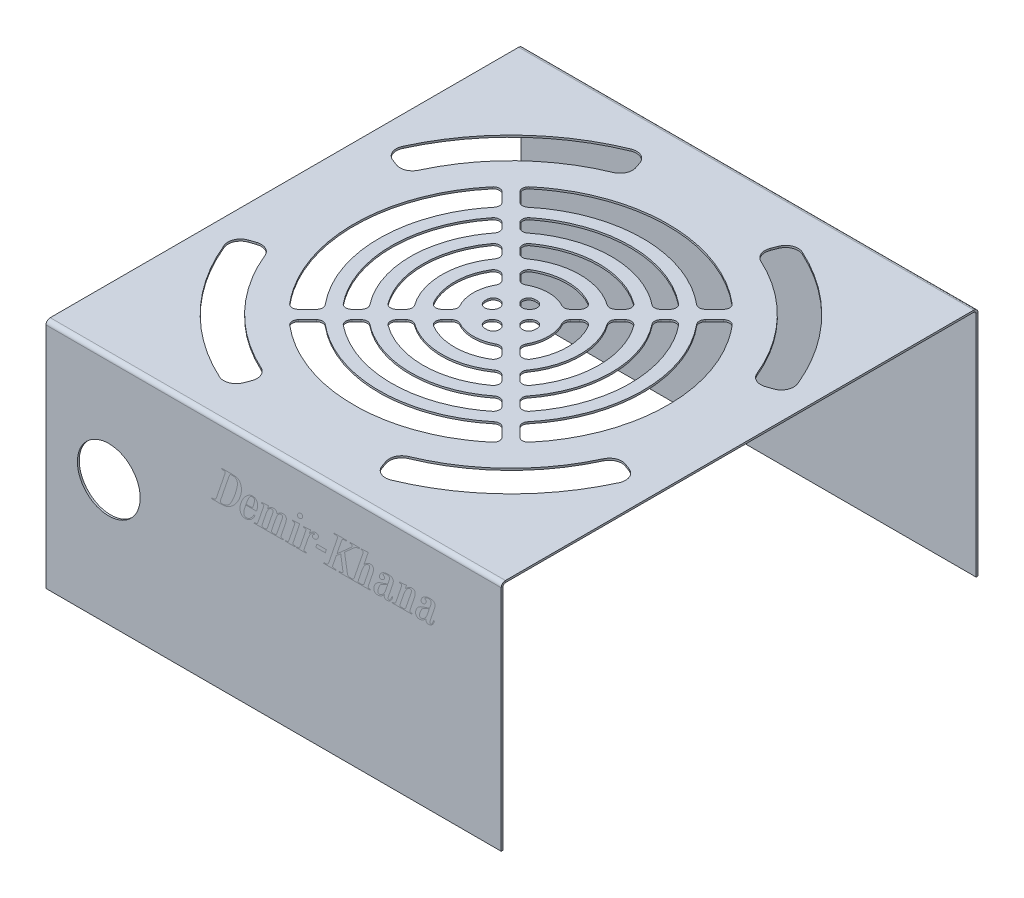
from build123d import *

# Parameters (mm, degrees)
BASE_FLANGE1_DEPTH = 72.5
VENT1_START        = 73.44
VENT1_DEPTH        = 0.6
CUT_EXTRUDE1_DEPTH = 10
SKETCH8_R          = 10
CUT_EXTRUDE2_DEPTH = 0.6


# Read off the part's stored shape, not the designer's step: Vent1
# Sheet-metal steps are written as plain solids
with BuildPart() as part:
    # Sketch1 → Base-Flange1 (new, symmetric)
    with BuildSketch(Plane(origin=(0, 0, 0), x_dir=(0, 0, -1), z_dir=(1, 0, 0))):
        with BuildLine():
            Line((0, 0), (0, 72.7034))
            ThreePointArc((0, 72.7034), (0.215745145, 73.224254855), (0.7366, 73.44))
            Line((0.7366, 73.44), (149.9334, 73.44))
            ThreePointArc((149.9334, 73.44), (150.454254855, 73.224254855), (150.67, 72.7034))
            Line((150.67, 72.7034), (150.67, 0))
            Line((150.67, 0), (151.27, 0))
            Line((151.27, 0), (151.27, 72.7034))
            ThreePointArc((151.27, 72.7034), (150.878518924, 73.648518924), (149.9334, 74.04))
            Line((149.9334, 74.04), (0.7366, 74.04))
            ThreePointArc((0.7366, 74.04), (-0.208518924, 73.648518924), (-0.6, 72.7034))
            Line((-0.6, 72.7034), (-0.6, 0))
            Line((-0.6, 0), (0, 0))
        make_face()
    extrude(amount=BASE_FLANGE1_DEPTH, both=True)

    # Vent1 outline → Vent1 (cut)
    with BuildSketch(Plane(origin=(0, 0, 0), x_dir=(1, 0, 0), z_dir=(0, 1, 0)).offset(VENT1_START)):
        with BuildLine():
            ThreePointArc((-35.237668545, 107.40924142), (-36.735185194, 107.993292253), (-38.17889489, 107.286628399))
            add(Edge.make_bspline(
                [(-38.17889489, 107.286628399), (-38.337593554, 107.099004687), (-39.542377698, 105.653034091), (-41.639734537, 102.823002226), (-44.167935511, 98.608358751), (-46.267637176, 94.164881819), (-47.925023327, 89.537993996), (-49.117500466, 84.770265753), (-49.840379372, 79.908942285), (-50.079805759, 75.000183853), (-49.840397589, 70.091242674), (-49.117572202, 65.230094889), (-47.925077278, 60.462183854), (-46.267777889, 55.8354579), (-44.16802313, 51.391805148), (-41.639938796, 47.177303544), (-39.542488916, 44.347113272), (-38.33771236, 42.901135881), (-38.178894637, 42.713371463)],
                knots=[0.388277454, 0.388277454, 0.388277454, 0.388277454, 0.390624117, 0.406249996, 0.421874117, 0.437499996, 0.453124117, 0.468749996, 0.484374117, 0.499999996, 0.515624117, 0.531249996, 0.546874117, 0.562499996, 0.578124117, 0.593749996, 0.609374117, 0.61172254, 0.61172254, 0.61172254, 0.61172254], degree=3))
            ThreePointArc((-38.178894637, 42.713371463), (-36.735184981, 42.006707815), (-35.237668471, 42.590758654))
            Line((-35.237668471, 42.590758654), (-32.398421968, 45.430005157))
            ThreePointArc((-32.398421968, 45.430005157), (-31.814704678, 46.753266478), (-32.275778554, 48.124090054))
            add(Edge.make_bspline(
                [(-32.275778476, 101.875910081), (-32.339681127, 101.799176391), (-33.279116704, 100.662839753), (-34.977369953, 98.37133243), (-37.101062803, 94.831027013), (-38.864810367, 91.098512463), (-40.25701773, 87.211921101), (-41.258697914, 83.207035691), (-41.865918043, 79.123517909), (-42.067036838, 75.000167139), (-41.865934603, 70.876650236), (-41.258763128, 66.793292165), (-40.257066776, 62.788240582), (-38.86493829, 58.90179637), (-37.101142449, 55.169121994), (-34.977555668, 51.628945513), (-33.279217278, 49.33729472), (-32.339788351, 48.200952392), (-32.275778554, 48.124090054)],
                knots=[0.389488825, 0.389488825, 0.389488825, 0.389488825, 0.390624044, 0.406249995, 0.421874044, 0.437499995, 0.453124044, 0.468749995, 0.484374044, 0.499999995, 0.515624044, 0.531249995, 0.546874044, 0.562499995, 0.578124044, 0.593749995, 0.609374044, 0.610511167, 0.610511167, 0.610511167, 0.610511167], degree=3))
            ThreePointArc((-32.275778476, 101.875910081), (-31.8147047, 103.246733617), (-32.398421987, 104.569994862))
            Line((-32.398421987, 104.569994862), (-35.237668545, 107.40924142))
        make_face()
        with BuildLine():
            ThreePointArc((32.409241439, 110.237668563), (32.993292271, 111.735185236), (32.286628381, 113.17889494))
            add(Edge.make_bspline(
                [(32.286628381, 113.17889494), (32.099004677, 113.33759359), (30.653034061, 114.542377664), (27.822998563, 116.639736542), (23.608356035, 119.167939391), (19.164870079, 121.267641643), (14.537985982, 122.925025916), (9.770249341, 124.11750369), (4.908933883, 124.84038021), (0.000167137, 125.079805759), (-4.908765728, 124.840396753), (-9.769921523, 124.117568978), (-14.53782416, 122.925074689), (-19.164553841, 121.267773423), (-23.60819756, 119.168019245), (-27.822700147, 116.639936816), (-30.652886651, 114.542488918), (-32.098864078, 113.337712403), (-32.28662848, 113.178894708)],
                knots=[0.138277454, 0.138277454, 0.138277454, 0.138277454, 0.140624117, 0.156249996, 0.171874157, 0.187499996, 0.203124197, 0.218749996, 0.234374197, 0.249999996, 0.265624197, 0.281249996, 0.296874197, 0.312499996, 0.328124157, 0.343749996, 0.359374117, 0.361722539, 0.361722539, 0.361722539, 0.361722539], degree=3))
            ThreePointArc((-32.28662848, 113.178894708), (-32.993292196, 111.735185039), (-32.409241358, 110.237668483))
            Line((-32.409241358, 110.237668483), (-29.569994843, 107.398421968))
            ThreePointArc((-29.569994843, 107.398421968), (-28.246733522, 106.814704678), (-26.875909946, 107.275778554))
            add(Edge.make_bspline(
                [(26.87591017, 107.275778424), (26.799182886, 107.339675735), (25.662846467, 108.279111594), (23.371342666, 109.977362674), (19.831031747, 112.101062699), (16.098516165, 113.864808438), (12.21192117, 115.257017867), (8.207035672, 116.258697877), (4.123517913, 116.865918052), (0.000167138, 117.067036836), (-4.123349764, 116.865934604), (-8.206707835, 116.258763128), (-12.211759418, 115.257066776), (-16.09820363, 113.86493829), (-19.830878006, 112.101142449), (-23.371054487, 109.977555668), (-25.66270528, 108.279217278), (-26.799047608, 107.339788351), (-26.875909946, 107.275778554)],
                knots=[0.139488824, 0.139488824, 0.139488824, 0.139488824, 0.140623949, 0.156249995, 0.171873996, 0.187499995, 0.203124044, 0.218749995, 0.234374044, 0.249999995, 0.265624044, 0.281249995, 0.296874044, 0.312499995, 0.328124044, 0.343749995, 0.359374044, 0.360511167, 0.360511167, 0.360511167, 0.360511167], degree=3))
            ThreePointArc((26.87591017, 107.275778424), (28.246733679, 106.814704715), (29.569994874, 107.398421999))
            Line((29.569994874, 107.398421999), (32.409241439, 110.237668563))
        make_face()
        with BuildLine():
            ThreePointArc((-32.409242255, 39.762330621), (-32.993293095, 38.264814132), (-32.286629479, 36.821104482))
            add(Edge.make_bspline(
                [(-32.286629479, 36.821104482), (-32.099002484, 36.66240299), (-30.653031738, 35.457618801), (-27.822991581, 33.360258793), (-23.608351397, 30.832060385), (-19.164866351, 28.732356461), (-14.537985919, 27.074974211), (-9.770249358, 25.882496276), (-4.908933878, 25.159619798), (-0.000167139, 24.920194241), (4.908765733, 25.159603238), (9.769921504, 25.882431059), (14.53782423, 27.074925174), (19.164557543, 28.732228506), (23.608202294, 30.831980859), (27.822710384, 33.360070464), (30.652893317, 35.457516171), (32.098870457, 36.66229296), (32.286628455, 36.821105228)],
                knots=[0.638277453, 0.638277453, 0.638277453, 0.638277453, 0.640624157, 0.656249996, 0.671874197, 0.687499996, 0.703124197, 0.718749996, 0.734374197, 0.749999996, 0.765624197, 0.781249996, 0.796874197, 0.812499996, 0.828124197, 0.843749996, 0.859374197, 0.861722539, 0.861722539, 0.861722539, 0.861722539], degree=3))
            ThreePointArc((32.286628455, 36.821105228), (32.993292217, 38.264814907), (32.409241381, 39.762331494))
            Line((32.409241381, 39.762331494), (29.569994843, 42.601578032))
            ThreePointArc((29.569994843, 42.601578032), (28.246733522, 43.185295322), (26.875909946, 42.724221446))
            add(Edge.make_bspline(
                [(-26.875910081, 42.724221524), (-26.799176391, 42.660318873), (-25.662839753, 41.720883296), (-23.37133243, 40.022630047), (-19.831027013, 37.898937197), (-16.098512463, 36.135189633), (-12.211921101, 34.74298227), (-8.207035691, 33.741302086), (-4.123517909, 33.134081957), (-0.000167139, 32.932963162), (4.123349764, 33.134065397), (8.206707835, 33.741236872), (12.211759418, 34.742933224), (16.09820363, 36.13506171), (19.830878006, 37.898857551), (23.371054487, 40.022444332), (25.66270528, 41.720782722), (26.799047608, 42.660211649), (26.875909946, 42.724221446)],
                knots=[0.639488825, 0.639488825, 0.639488825, 0.639488825, 0.640624044, 0.656249995, 0.671874044, 0.687499995, 0.703124044, 0.718749995, 0.734374044, 0.749999995, 0.765624044, 0.781249995, 0.796874044, 0.812499995, 0.828124044, 0.843749995, 0.859374044, 0.860511167, 0.860511167, 0.860511167, 0.860511167], degree=3))
            ThreePointArc((-26.875910081, 42.724221524), (-28.246733617, 43.1852953), (-29.569994862, 42.601578013))
            Line((-29.569994862, 42.601578013), (-32.409242255, 39.762330621))
        make_face()
        with BuildLine():
            ThreePointArc((35.237668542, 42.590758583), (36.735185185, 42.006707749), (38.178894879, 42.713371594))
            add(Edge.make_bspline(
                [(38.178894879, 42.713371594), (38.337598954, 42.901001701), (39.542382752, 44.346972604), (41.639743794, 47.177011677), (44.167939595, 51.391648685), (46.267643196, 55.835133674), (47.925027181, 60.462013899), (49.117508708, 65.229792176), (49.840403961, 70.091105929), (50.000006913, 73.363674722), (50, 75), (49.999993088, 76.636236998), (49.840371138, 79.908801135), (49.117566807, 84.76995079), (47.925075713, 89.53781594), (46.26777831, 94.164542157), (44.168023011, 98.608194829), (41.639938851, 102.822696488), (39.542488886, 105.652886622), (38.337712436, 107.098864068), (38.178894755, 107.286628464)],
                knots=[0.888277454, 0.888277454, 0.888277454, 0.888277454, 0.890624197, 0.906249996, 0.921874197, 0.937499996, 0.953124197, 0.968749996, 0.984374599, 1, 1, 1, 1.015624558, 1.031249996, 1.046874117, 1.062499996, 1.078124117, 1.093749996, 1.109374117, 1.111722539, 1.111722539, 1.111722539, 1.111722539], degree=3))
            ThreePointArc((38.178894755, 107.286628464), (36.735185079, 107.993292213), (35.237668501, 107.409241376))
            Line((35.237668501, 107.409241376), (32.398421965, 104.569994841))
            ThreePointArc((32.398421965, 104.569994841), (31.814704675, 103.246733509), (32.275778565, 101.875909927))
            add(Edge.make_bspline(
                [(32.275778474, 48.124089915), (32.339681125, 48.200823606), (33.2791167, 49.337160246), (34.977369926, 51.628667574), (37.101062903, 55.168972973), (38.864809991, 58.901487587), (40.257019132, 62.788078711), (41.258702895, 66.793005846), (41.865941804, 70.876521899), (42.000006913, 73.625480045), (42, 75), (41.999993088, 76.374431675), (41.86590898, 79.123385165), (41.258760994, 83.20673712), (40.257067663, 87.211751128), (38.864945105, 91.098188243), (37.101146318, 94.830870541), (34.977564983, 98.371040592), (33.279222316, 100.662698558), (32.339793717, 101.79904116), (32.275778565, 101.875909927)],
                knots=[0.889488825, 0.889488825, 0.889488825, 0.889488825, 0.890624044, 0.906249995, 0.921874044, 0.937499995, 0.953124044, 0.968749995, 0.984374522, 1, 1, 1, 1.015624474, 1.031249995, 1.046873949, 1.062499995, 1.078123949, 1.093749995, 1.109373949, 1.110511166, 1.110511166, 1.110511166, 1.110511166], degree=3))
            ThreePointArc((32.275778474, 48.124089915), (31.814704701, 46.753266381), (32.398421987, 45.430005138))
            Line((32.398421987, 45.430005138), (35.237668542, 42.590758583))
        make_face()
        with BuildLine():
            ThreePointArc((-1.748044523, 70.423528352), (-2.202201241, 68.295737536), (-0.445257533, 67.012421172))
            add(Edge.make_bspline(
                [(-0.445257533, 67.012421172), (-0.296991368, 67.004147926), (0, 66.995852074), (0.296991368, 67.004147926), (0.445257551, 67.012421173)],
                knots=[0.741137243, 0.741137243, 0.741137243, 0.741137243, 0.75, 0.758862757, 0.758862757, 0.758862757, 0.758862757], degree=3))
            ThreePointArc((0.445257551, 67.012421173), (2.202201241, 68.295737535), (1.748044523, 70.423528352))
            Line((1.748044523, 70.423528352), (1.414213562, 70.757359313))
            ThreePointArc((1.414213562, 70.757359313), (0, 71.343145751), (-1.414213562, 70.757359313))
            Line((-1.414213562, 70.757359313), (-1.748044523, 70.423528352))
        make_face()
        with BuildLine():
            add(Edge.make_bspline(
                [(-5.707183993, 64.44410446), (-5.344945674, 64.248259161), (-4.26255561, 63.733002904), (-2.356174944, 63.154708651), (0, 62.922645674), (2.356174944, 63.154708651), (4.262555613, 63.733002905), (5.344945679, 64.248259164), (5.707184, 64.444104464)],
                knots=[0.671115403, 0.671115403, 0.671115403, 0.671115403, 0.6875, 0.71875, 0.75, 0.78125, 0.8125, 0.828884597, 0.828884597, 0.828884597, 0.828884597], degree=3))
            ThreePointArc((-5.707183993, 64.44410446), (-6.947118124, 64.663820908), (-8.072584978, 64.098987897))
            Line((-8.072584978, 64.098987897), (-9.540203201, 62.631369674))
            ThreePointArc((-9.540203201, 62.631369674), (-10.110041057, 60.965084752), (-9.141633618, 59.494232055))
            add(Edge.make_bspline(
                [(-9.141633618, 59.494232055), (-8.417949604, 59.067628623), (-6.607666297, 58.164369851), (-3.534262417, 57.232062977), (0, 56.883968512), (3.534262417, 57.232062977), (6.607666296, 58.164369851), (8.417949603, 59.067628622), (9.141633653, 59.494232075)],
                knots=[0.665216574, 0.665216574, 0.665216574, 0.665216574, 0.6875, 0.71875, 0.75, 0.78125, 0.8125, 0.834783426, 0.834783426, 0.834783426, 0.834783426], degree=3))
            ThreePointArc((9.141633653, 59.494232075), (10.110041057, 60.965084752), (9.540203201, 62.631369674))
            Line((9.540203201, 62.631369674), (8.072584978, 64.098987897))
            ThreePointArc((8.072584978, 64.098987897), (6.947118124, 64.663820908), (5.707184, 64.444104464))
        make_face()
        with BuildLine():
            ThreePointArc((-4.576471648, 76.748044523), (-6.704262464, 77.202201241), (-7.987578828, 75.445257533))
            add(Edge.make_bspline(
                [(-7.987578828, 75.445257533), (-7.995852074, 75.296991368), (-8.004147926, 75), (-7.995852074, 74.703008632), (-7.987578827, 74.554742449)],
                knots=[0.491137243, 0.491137243, 0.491137243, 0.491137243, 0.5, 0.508862757, 0.508862757, 0.508862757, 0.508862757], degree=3))
            ThreePointArc((-7.987578827, 74.554742449), (-6.704262465, 72.797798759), (-4.576471648, 73.251955477))
            Line((-4.576471648, 73.251955477), (-4.242640687, 73.585786438))
            ThreePointArc((-4.242640687, 73.585786438), (-3.656854249, 75), (-4.242640687, 76.414213562))
            Line((-4.242640687, 76.414213562), (-4.576471648, 76.748044523))
        make_face()
        with BuildLine():
            add(Edge.make_bspline(
                [(-10.55589554, 80.707183993), (-10.751740839, 80.344945674), (-11.266997096, 79.26255561), (-11.845291349, 77.356174944), (-12.077354326, 75), (-11.845291349, 72.643825056), (-11.266997095, 70.737444387), (-10.751740836, 69.655054321), (-10.555895536, 69.292816)],
                knots=[0.421115403, 0.421115403, 0.421115403, 0.421115403, 0.4375, 0.46875, 0.5, 0.53125, 0.5625, 0.578884597, 0.578884597, 0.578884597, 0.578884597], degree=3))
            ThreePointArc((-10.55589554, 80.707183993), (-10.336179092, 81.947118124), (-10.901012103, 83.072584978))
            Line((-10.901012103, 83.072584978), (-12.368630326, 84.540203201))
            ThreePointArc((-12.368630326, 84.540203201), (-14.034915248, 85.110041057), (-15.505767945, 84.141633618))
            add(Edge.make_bspline(
                [(-15.505767945, 84.141633618), (-15.932371377, 83.417949604), (-16.835630149, 81.607666297), (-17.767937023, 78.534262417), (-18.116031488, 75), (-17.767937023, 71.465737583), (-16.835630149, 68.392333704), (-15.932371378, 66.582050397), (-15.505767925, 65.858366347)],
                knots=[0.415216574, 0.415216574, 0.415216574, 0.415216574, 0.4375, 0.46875, 0.5, 0.53125, 0.5625, 0.584783426, 0.584783426, 0.584783426, 0.584783426], degree=3))
            ThreePointArc((-15.505767925, 65.858366347), (-14.034915248, 64.889958943), (-12.368630326, 65.459796799))
            Line((-12.368630326, 65.459796799), (-10.901012103, 66.927415022))
            ThreePointArc((-10.901012103, 66.927415022), (-10.336179092, 68.052881876), (-10.555895536, 69.292816))
        make_face()
        with BuildLine():
            ThreePointArc((1.748044523, 79.576471648), (2.202201241, 81.704262464), (0.445257533, 82.987578828))
            add(Edge.make_bspline(
                [(0.445257533, 82.987578828), (0.296991368, 82.995852074), (0, 83.004147926), (-0.296991368, 82.995852074), (-0.445257551, 82.987578827)],
                knots=[0.241137243, 0.241137243, 0.241137243, 0.241137243, 0.25, 0.258862757, 0.258862757, 0.258862757, 0.258862757], degree=3))
            ThreePointArc((-0.445257551, 82.987578827), (-2.202201241, 81.704262465), (-1.748044523, 79.576471648))
            Line((-1.748044523, 79.576471648), (-1.414213562, 79.242640687))
            ThreePointArc((-1.414213562, 79.242640687), (0, 78.656854249), (1.414213562, 79.242640687))
            Line((1.414213562, 79.242640687), (1.748044523, 79.576471648))
        make_face()
        with BuildLine():
            add(Edge.make_bspline(
                [(5.707183993, 85.55589554), (5.344945674, 85.751740839), (4.26255561, 86.266997096), (2.356174944, 86.845291349), (0, 87.077354326), (-2.356174944, 86.845291349), (-4.262555613, 86.266997095), (-5.344945679, 85.751740836), (-5.707184, 85.555895536)],
                knots=[0.171115403, 0.171115403, 0.171115403, 0.171115403, 0.1875, 0.21875, 0.25, 0.28125, 0.3125, 0.328884597, 0.328884597, 0.328884597, 0.328884597], degree=3))
            ThreePointArc((5.707183993, 85.55589554), (6.947118124, 85.336179092), (8.072584978, 85.901012103))
            Line((8.072584978, 85.901012103), (9.540203201, 87.368630326))
            ThreePointArc((9.540203201, 87.368630326), (10.110041057, 89.034915248), (9.141633618, 90.505767945))
            add(Edge.make_bspline(
                [(9.141633618, 90.505767945), (8.417949604, 90.932371377), (6.607666297, 91.835630149), (3.534262417, 92.767937023), (0, 93.116031488), (-3.534262417, 92.767937023), (-6.607666296, 91.835630149), (-8.417949603, 90.932371378), (-9.141633653, 90.505767925)],
                knots=[0.165216574, 0.165216574, 0.165216574, 0.165216574, 0.1875, 0.21875, 0.25, 0.28125, 0.3125, 0.334783426, 0.334783426, 0.334783426, 0.334783426], degree=3))
            ThreePointArc((-9.141633653, 90.505767925), (-10.110041057, 89.034915248), (-9.540203201, 87.368630326))
            Line((-9.540203201, 87.368630326), (-8.072584978, 85.901012103))
            ThreePointArc((-8.072584978, 85.901012103), (-6.947118124, 85.336179092), (-5.707184, 85.555895536))
        make_face()
        with BuildLine():
            add(Edge.make_bspline(
                [(10.55589554, 69.292816007), (10.751740839, 69.655054326), (11.266997096, 70.73744439), (11.845291349, 72.643825056), (12, 74.214608352), (12, 75), (12, 75.785391648), (11.845291349, 77.356174944), (11.266997095, 79.262555613), (10.751740836, 80.344945679), (10.555895536, 80.707184)],
                knots=[0.921115403, 0.921115403, 0.921115403, 0.921115403, 0.9375, 0.96875, 1, 1, 1, 1.03125, 1.0625, 1.078884597, 1.078884597, 1.078884597, 1.078884597], degree=3))
            ThreePointArc((10.55589554, 69.292816007), (10.336179092, 68.052881876), (10.901012103, 66.927415022))
            Line((10.901012103, 66.927415022), (12.368630326, 65.459796799))
            ThreePointArc((12.368630326, 65.459796799), (14.034915248, 64.889958943), (15.505767945, 65.858366382))
            add(Edge.make_bspline(
                [(15.505767945, 65.858366382), (15.932371377, 66.582050396), (16.835630149, 68.392333703), (17.767937023, 71.465737583), (18, 73.821912528), (18, 75), (18, 76.178087472), (17.767937023, 78.534262417), (16.835630149, 81.607666296), (15.932371378, 83.417949603), (15.505767925, 84.141633653)],
                knots=[0.915216574, 0.915216574, 0.915216574, 0.915216574, 0.9375, 0.96875, 1, 1, 1, 1.03125, 1.0625, 1.084783426, 1.084783426, 1.084783426, 1.084783426], degree=3))
            ThreePointArc((15.505767925, 84.141633653), (14.034915248, 85.110041057), (12.368630326, 84.540203201))
            Line((12.368630326, 84.540203201), (10.901012103, 83.072584978))
            ThreePointArc((10.901012103, 83.072584978), (10.336179092, 81.947118124), (10.555895536, 80.707184))
        make_face()
        with BuildLine():
            ThreePointArc((4.576471648, 73.251955477), (6.704262466, 72.79779876), (7.987578828, 74.554742471))
            add(Edge.make_bspline(
                [(7.987578828, 74.554742471), (7.995852074, 74.703008632), (8, 74.851504316), (8, 75), (8, 75.148495684), (7.995852074, 75.296991368), (7.987578827, 75.445257551)],
                knots=[0.991137243, 0.991137243, 0.991137243, 0.991137243, 1, 1, 1, 1.008862757, 1.008862757, 1.008862757, 1.008862757], degree=3))
            ThreePointArc((7.987578827, 75.445257551), (6.704262463, 77.202201241), (4.576471648, 76.748044523))
            Line((4.576471648, 76.748044523), (4.242640687, 76.414213562))
            ThreePointArc((4.242640687, 76.414213562), (3.656854249, 75), (4.242640687, 73.585786438))
            Line((4.242640687, 73.585786438), (4.576471648, 73.251955477))
        make_face()
        with BuildLine():
            add(Edge.make_bspline(
                [(-12.745942792, 57.068463804), (-12.573229067, 56.945682241), (-11.213115362, 56.008087624), (-8.473306247, 54.543629141), (-4.319654065, 53.283632527), (0, 52.858183736), (4.319654065, 53.283632527), (8.473306247, 54.543629141), (11.213115362, 56.008087624), (12.573229067, 56.945682241), (12.745942792, 57.068463804)],
                knots=[0.65165093, 0.65165093, 0.65165093, 0.65165093, 0.65625, 0.6875, 0.71875, 0.75, 0.78125, 0.8125, 0.84375, 0.84834907, 0.84834907, 0.84834907, 0.84834907], degree=3))
            ThreePointArc((-12.745942792, 57.068463804), (-14.071959063, 57.43138655), (-15.31897145, 56.852601425))
            Line((-15.31897145, 56.852601425), (-16.751653306, 55.41991957))
            ThreePointArc((-16.751653306, 55.41991957), (-17.331483334, 53.851465415), (-16.517351618, 52.390835125))
            add(Edge.make_bspline(
                [(-16.517351618, 52.390835125), (-16.201632209, 52.160153474), (-14.37874274, 50.885937781), (-10.78420795, 48.964618907), (-5.497741537, 47.360986853), (0, 46.819506574), (5.497741537, 47.360986853), (10.78420795, 48.964618907), (14.37874274, 50.885937781), (16.201632209, 52.160153474), (16.517351619, 52.390835125)],
                knots=[0.649582268, 0.649582268, 0.649582268, 0.649582268, 0.65625, 0.6875, 0.71875, 0.75, 0.78125, 0.8125, 0.84375, 0.850417732, 0.850417732, 0.850417732, 0.850417732], degree=3))
            ThreePointArc((16.517351619, 52.390835125), (17.331483334, 53.851465416), (16.751653306, 55.41991957))
            Line((16.751653306, 55.41991957), (15.31897145, 56.852601425))
            ThreePointArc((15.31897145, 56.852601425), (14.07195906, 57.43138655), (12.745942792, 57.068463804))
        make_face()
        with BuildLine():
            add(Edge.make_bspline(
                [(-17.931536196, 87.745942792), (-18.054317759, 87.573229067), (-18.991912376, 86.213115362), (-20.456370859, 83.473306247), (-21.716367473, 79.319654065), (-22.141816264, 75), (-21.716367473, 70.680345935), (-20.456370859, 66.526693753), (-18.991912376, 63.786884638), (-18.054317759, 62.426770933), (-17.931536196, 62.254057208)],
                knots=[0.40165093, 0.40165093, 0.40165093, 0.40165093, 0.40625, 0.4375, 0.46875, 0.5, 0.53125, 0.5625, 0.59375, 0.59834907, 0.59834907, 0.59834907, 0.59834907], degree=3))
            ThreePointArc((-17.931536196, 87.745942792), (-17.56861345, 89.071959063), (-18.147398575, 90.31897145))
            Line((-18.147398575, 90.31897145), (-19.58008043, 91.751653306))
            ThreePointArc((-19.58008043, 91.751653306), (-21.148534585, 92.331483334), (-22.609164875, 91.517351618))
            add(Edge.make_bspline(
                [(-22.609164875, 91.517351618), (-22.839846526, 91.201632209), (-24.114062219, 89.37874274), (-26.035381093, 85.78420795), (-27.639013147, 80.497741537), (-28.180493426, 75), (-27.639013147, 69.502258463), (-26.035381093, 64.21579205), (-24.114062219, 60.62125726), (-22.839846526, 58.798367791), (-22.609164875, 58.482648381)],
                knots=[0.399582268, 0.399582268, 0.399582268, 0.399582268, 0.40625, 0.4375, 0.46875, 0.5, 0.53125, 0.5625, 0.59375, 0.600417732, 0.600417732, 0.600417732, 0.600417732], degree=3))
            ThreePointArc((-22.609164875, 58.482648381), (-21.148534584, 57.668516666), (-19.58008043, 58.248346694))
            Line((-19.58008043, 58.248346694), (-18.147398575, 59.68102855))
            ThreePointArc((-18.147398575, 59.68102855), (-17.56861345, 60.92804094), (-17.931536196, 62.254057208))
        make_face()
        with BuildLine():
            add(Edge.make_bspline(
                [(12.745942792, 92.931536196), (12.573229067, 93.054317759), (11.213115362, 93.991912376), (8.473306247, 95.456370859), (4.319654065, 96.716367473), (0, 97.141816264), (-4.319654065, 96.716367473), (-8.473306247, 95.456370859), (-11.213115362, 93.991912376), (-12.573229067, 93.054317759), (-12.745942792, 92.931536196)],
                knots=[0.15165093, 0.15165093, 0.15165093, 0.15165093, 0.15625, 0.1875, 0.21875, 0.25, 0.28125, 0.3125, 0.34375, 0.34834907, 0.34834907, 0.34834907, 0.34834907], degree=3))
            ThreePointArc((12.745942792, 92.931536196), (14.071959063, 92.56861345), (15.31897145, 93.147398575))
            Line((15.31897145, 93.147398575), (16.751653306, 94.58008043))
            ThreePointArc((16.751653306, 94.58008043), (17.331483334, 96.148534585), (16.517351618, 97.609164875))
            add(Edge.make_bspline(
                [(16.517351618, 97.609164875), (16.201632209, 97.839846526), (14.37874274, 99.114062219), (10.78420795, 101.035381093), (5.497741537, 102.639013147), (0, 103.180493426), (-5.497741537, 102.639013147), (-10.78420795, 101.035381093), (-14.37874274, 99.114062219), (-16.201632209, 97.839846526), (-16.517351619, 97.609164875)],
                knots=[0.149582268, 0.149582268, 0.149582268, 0.149582268, 0.15625, 0.1875, 0.21875, 0.25, 0.28125, 0.3125, 0.34375, 0.350417732, 0.350417732, 0.350417732, 0.350417732], degree=3))
            ThreePointArc((-16.517351619, 97.609164875), (-17.331483334, 96.148534584), (-16.751653306, 94.58008043))
            Line((-16.751653306, 94.58008043), (-15.31897145, 93.147398575))
            ThreePointArc((-15.31897145, 93.147398575), (-14.07195906, 92.56861345), (-12.745942792, 92.931536196))
        make_face()
        with BuildLine():
            add(Edge.make_bspline(
                [(17.931536196, 62.254057208), (18.054317759, 62.426770933), (18.991912376, 63.786884638), (20.456370859, 66.526693753), (21.716367473, 70.680345935), (22, 73.560115312), (22, 75), (22, 76.439884688), (21.716367473, 79.319654065), (20.456370859, 83.473306247), (18.991912376, 86.213115362), (18.054317759, 87.573229067), (17.931536196, 87.745942792)],
                knots=[0.90165093, 0.90165093, 0.90165093, 0.90165093, 0.90625, 0.9375, 0.96875, 1, 1, 1, 1.03125, 1.0625, 1.09375, 1.09834907, 1.09834907, 1.09834907, 1.09834907], degree=3))
            ThreePointArc((17.931536196, 62.254057208), (17.56861345, 60.928040937), (18.147398575, 59.68102855))
            Line((18.147398575, 59.68102855), (19.58008043, 58.248346694))
            ThreePointArc((19.58008043, 58.248346694), (21.148534585, 57.668516666), (22.609164875, 58.482648382))
            add(Edge.make_bspline(
                [(22.609164875, 58.482648382), (22.839846526, 58.798367791), (24.114062219, 60.62125726), (26.035381093, 64.21579205), (27.639013147, 69.502258463), (28, 73.167419488), (28, 75), (28, 76.832580512), (27.639013147, 80.497741537), (26.035381093, 85.78420795), (24.114062219, 89.37874274), (22.839846526, 91.201632209), (22.609164875, 91.517351619)],
                knots=[0.899582268, 0.899582268, 0.899582268, 0.899582268, 0.90625, 0.9375, 0.96875, 1, 1, 1, 1.03125, 1.0625, 1.09375, 1.100417732, 1.100417732, 1.100417732, 1.100417732], degree=3))
            ThreePointArc((22.609164875, 91.517351619), (21.148534584, 92.331483334), (19.58008043, 91.751653306))
            Line((19.58008043, 91.751653306), (18.147398575, 90.31897145))
            ThreePointArc((18.147398575, 90.31897145), (17.56861345, 89.07195906), (17.931536196, 87.745942792))
        make_face()
        with BuildLine():
            add(Edge.make_bspline(
                [(-19.808104351, 49.8677173), (-19.151097198, 49.349861828), (-16.778177952, 47.625654003), (-12.324809086, 45.245278751), (-6.283133185, 43.412556403), (0, 42.793721798), (6.283133185, 43.412556403), (12.324809086, 45.245278751), (16.778177952, 47.625654003), (19.151097198, 49.349861828), (19.808104351, 49.8677173)],
                knots=[0.643767906, 0.643767906, 0.643767906, 0.643767906, 0.65625, 0.6875, 0.71875, 0.75, 0.78125, 0.8125, 0.84375, 0.856232094, 0.856232094, 0.856232094, 0.856232094], degree=3))
            ThreePointArc((-19.808104351, 49.8677173), (-21.163986968, 50.293508483), (-22.460377231, 49.711195644))
            Line((-22.460377231, 49.711195644), (-23.884306644, 48.287266231))
            ThreePointArc((-23.884306644, 48.287266231), (-24.466989486, 46.761676059), (-23.718269273, 45.310344701))
            add(Edge.make_bspline(
                [(-23.718269273, 45.310344701), (-22.876975008, 44.638380717), (-21.002200978, 43.267855292), (-17.942364964, 41.432375423), (-14.565335481, 39.836606268), (-11.048888702, 38.576986286), (-7.425428855, 37.670704995), (-3.730809924, 37.121313036), (-0.000167139, 36.939347622), (3.73064178, 37.121296476), (7.425101001, 37.670639778), (11.048727012, 38.576937249), (14.565026673, 39.836478313), (17.942215862, 41.432295897), (21.002066601, 43.267756356), (22.876974623, 44.638381519), (23.718268862, 45.310345839)],
                knots=[0.642721101, 0.642721101, 0.642721101, 0.642721101, 0.656249995, 0.671873944, 0.687499995, 0.703123944, 0.718749995, 0.734373944, 0.749999995, 0.765623944, 0.781249995, 0.796873944, 0.812499995, 0.828123944, 0.843749995, 0.857278892, 0.857278892, 0.857278892, 0.857278892], degree=3))
            ThreePointArc((23.718268862, 45.310345839), (24.466988685, 46.761677133), (23.884305829, 48.287267047))
            Line((23.884305829, 48.287267047), (22.460377231, 49.711195644))
            ThreePointArc((22.460377231, 49.711195644), (21.163986971, 50.293508483), (19.808104351, 49.8677173))
        make_face()
        with BuildLine():
            add(Edge.make_bspline(
                [(-25.1322827, 94.808104351), (-25.650138172, 94.151097198), (-27.374345997, 91.778177952), (-29.754721249, 87.324809086), (-31.587443597, 81.283133185), (-32.206278202, 75), (-31.587443597, 68.716866815), (-29.754721249, 62.675190914), (-27.374345997, 58.221822048), (-25.650138172, 55.848902802), (-25.1322827, 55.191895649)],
                knots=[0.393767906, 0.393767906, 0.393767906, 0.393767906, 0.40625, 0.4375, 0.46875, 0.5, 0.53125, 0.5625, 0.59375, 0.606232094, 0.606232094, 0.606232094, 0.606232094], degree=3))
            ThreePointArc((-25.1322827, 94.808104351), (-24.706491517, 96.163986968), (-25.288804356, 97.460377231))
            Line((-25.288804356, 97.460377231), (-26.71273292, 98.884305795))
            ThreePointArc((-26.71273292, 98.884305795), (-28.238322914, 99.466988647), (-29.689654228, 98.718268703))
            add(Edge.make_bspline(
                [(-29.689654228, 98.718268703), (-30.361618413, 97.876974493), (-31.732140169, 96.00220811), (-33.567620473, 92.942372319), (-35.163387369, 89.565350949), (-36.423011252, 86.048896779), (-37.329291747, 82.425445249), (-37.878686134, 78.730818331), (-38.060652378, 75.000183853), (-37.878704351, 71.269366628), (-37.329363483, 67.574915392), (-36.423065203, 63.951281072), (-35.163528082, 60.43498877), (-33.567708091, 57.057791581), (-31.732248533, 53.997940144), (-30.361618498, 52.123025272), (-29.689654124, 51.281731045)],
                knots=[0.392721099, 0.392721099, 0.392721099, 0.392721099, 0.406249994, 0.421873838, 0.437499994, 0.453123838, 0.468749994, 0.484373838, 0.499999994, 0.515623838, 0.531249994, 0.546873838, 0.562499994, 0.578123838, 0.593749994, 0.607278892, 0.607278892, 0.607278892, 0.607278892], degree=3))
            ThreePointArc((-29.689654124, 51.281731045), (-28.238322842, 50.533011292), (-26.712732974, 51.115694151))
            Line((-26.712732974, 51.115694151), (-25.288804356, 52.539622769))
            ThreePointArc((-25.288804356, 52.539622769), (-24.706491517, 53.836013029), (-25.1322827, 55.191895649))
        make_face()
        with BuildLine():
            add(Edge.make_bspline(
                [(19.808104351, 100.1322827), (19.151097198, 100.650138172), (16.778177952, 102.374345997), (12.324809086, 104.754721249), (6.283133185, 106.587443597), (0, 107.206278202), (-6.283133185, 106.587443597), (-12.324809086, 104.754721249), (-16.778177952, 102.374345997), (-19.151097198, 100.650138172), (-19.808104351, 100.1322827)],
                knots=[0.143767906, 0.143767906, 0.143767906, 0.143767906, 0.15625, 0.1875, 0.21875, 0.25, 0.28125, 0.3125, 0.34375, 0.356232094, 0.356232094, 0.356232094, 0.356232094], degree=3))
            ThreePointArc((19.808104351, 100.1322827), (21.163986968, 99.706491517), (22.460377231, 100.288804356))
            Line((22.460377231, 100.288804356), (23.884305795, 101.71273292))
            ThreePointArc((23.884305795, 101.71273292), (24.466988647, 103.238322914), (23.718268703, 104.689654228))
            add(Edge.make_bspline(
                [(23.718268703, 104.689654228), (22.876974493, 105.361618413), (21.00220811, 106.732140169), (17.942372319, 108.567620473), (14.565350949, 110.163387369), (11.048896779, 111.423011252), (7.425445249, 112.329291747), (3.730818331, 112.878686134), (0.000183853, 113.060652378), (-3.730633372, 112.878704351), (-7.425084608, 112.329363483), (-11.048718928, 111.423065202), (-14.565011232, 110.163528084), (-17.942208411, 108.567708084), (-21.002059862, 106.732248572), (-22.876974629, 105.361618483), (-23.71826887, 104.689654158)],
                knots=[0.142721099, 0.142721099, 0.142721099, 0.142721099, 0.156249994, 0.171873838, 0.187499994, 0.203123838, 0.218749994, 0.234373838, 0.249999994, 0.265623838, 0.281249994, 0.296873838, 0.312499994, 0.328123838, 0.343749994, 0.357278892, 0.357278892, 0.357278892, 0.357278892], degree=3))
            ThreePointArc((-23.71826887, 104.689654158), (-24.466988687, 103.238322865), (-23.88430583, 101.712732955))
            Line((-23.88430583, 101.712732955), (-22.460377231, 100.288804356))
            ThreePointArc((-22.460377231, 100.288804356), (-21.163986971, 99.706491517), (-19.808104351, 100.1322827))
        make_face()
        with BuildLine():
            add(Edge.make_bspline(
                [(25.1322827, 55.191895649), (25.650138172, 55.848902802), (27.374345997, 58.221822048), (29.754721249, 62.675190914), (31.587443597, 68.716866815), (32, 72.905622272), (32, 75), (32, 77.094377728), (31.587443597, 81.283133185), (29.754721249, 87.324809086), (27.374345997, 91.778177952), (25.650138172, 94.151097198), (25.1322827, 94.808104351)],
                knots=[0.893767906, 0.893767906, 0.893767906, 0.893767906, 0.90625, 0.9375, 0.96875, 1, 1, 1, 1.03125, 1.0625, 1.09375, 1.106232094, 1.106232094, 1.106232094, 1.106232094], degree=3))
            ThreePointArc((25.1322827, 55.191895649), (24.706491517, 53.836013032), (25.288804356, 52.539622769))
            Line((25.288804356, 52.539622769), (26.71273292, 51.115694204))
            ThreePointArc((26.71273292, 51.115694204), (28.238322915, 50.533011352), (29.689654229, 51.281731297))
            add(Edge.make_bspline(
                [(29.689654229, 51.281731297), (30.361618414, 52.123025506), (31.732145076, 53.997798634), (33.567624557, 57.057635117), (35.163393389, 60.434664544), (36.423015107, 63.951111117), (37.329299989, 67.574612681), (37.878710725, 71.269229883), (38.000006913, 73.756382707), (38, 75), (37.999993088, 76.243529013), (37.878677901, 78.73067718), (37.329358088, 82.425130285), (36.423063638, 86.048718722), (35.163528503, 89.565011287), (33.567707972, 92.942208396), (31.732248594, 96.002059868), (30.361618487, 97.876974636), (29.689654153, 98.718268878)],
                knots=[0.8927211, 0.8927211, 0.8927211, 0.8927211, 0.906249995, 0.921873944, 0.937499995, 0.953123944, 0.968749995, 0.984374472, 1, 1, 1, 1.015624419, 1.031249994, 1.046873838, 1.062499994, 1.078123838, 1.093749994, 1.107278892, 1.107278892, 1.107278892, 1.107278892], degree=3))
            ThreePointArc((29.689654153, 98.718268878), (28.238322862, 99.466988688), (26.712732956, 98.884305831))
            Line((26.712732956, 98.884305831), (25.288804356, 97.460377231))
            ThreePointArc((25.288804356, 97.460377231), (24.706491517, 96.163986971), (25.1322827, 94.808104351))
        make_face()
    extrude(amount=VENT1_DEPTH, mode=Mode.SUBTRACT)

    # Sketch7 → Cut-Extrude1 (cut)
    with BuildSketch(Plane(origin=(0, 74.04, 0), x_dir=(1, 0, 0), z_dir=(0, 1, 0))):
        with BuildLine():
            Line((-20.629155496, 135.451947392), (-21.276306238, 137.348366401))
            ThreePointArc((-21.276306238, 137.348366401), (-23.408229689, 139.698660225), (-26.580860333, 139.756913638))
            ThreePointArc((-26.580860333, 139.756913638), (-48.487173602, 125.487562786), (-63.630011671, 104.175702472))
            ThreePointArc((-63.630011671, 104.175702472), (-63.699998232, 101.003308968), (-61.437765649, 98.778161243))
            Line((-61.437765649, 98.778161243), (-59.569043927, 98.054912831))
            ThreePointArc((-59.569043927, 98.054912831), (-56.623595579, 98.077857405), (-54.492458702, 100.11119162))
            ThreePointArc((-54.492458702, 100.11119162), (-41.560434516, 118.275053816), (-22.888878081, 130.462593342))
            ThreePointArc((-22.888878081, 130.462593342), (-20.771094272, 132.50983152), (-20.629155496, 135.451947392))
        make_face()
        with BuildLine():
            Line((60.451947392, 95.629155496), (62.348366401, 96.276306238))
            ThreePointArc((62.348366401, 96.276306238), (64.698660225, 98.408229689), (64.756913638, 101.580860333))
            ThreePointArc((64.756913638, 101.580860333), (50.487562786, 123.487173602), (29.175702472, 138.630011671))
            ThreePointArc((29.175702472, 138.630011671), (26.003308968, 138.699998232), (23.778161243, 136.437765649))
            Line((23.778161243, 136.437765649), (23.054912831, 134.569043927))
            ThreePointArc((23.054912831, 134.569043927), (23.077857405, 131.623595579), (25.11119162, 129.492458702))
            ThreePointArc((25.11119162, 129.492458702), (43.275053816, 116.560434516), (55.462593342, 97.888878081))
            ThreePointArc((55.462593342, 97.888878081), (57.50983152, 95.771094272), (60.451947392, 95.629155496))
        make_face()
        with BuildLine():
            Line((20.629155496, 14.548052608), (21.276306238, 12.651633599))
            ThreePointArc((21.276306238, 12.651633599), (23.408229689, 10.301339775), (26.580860333, 10.243086362))
            ThreePointArc((26.580860333, 10.243086362), (48.487173602, 24.512437214), (63.630011671, 45.824297528))
            ThreePointArc((63.630011671, 45.824297528), (63.699998232, 48.996691032), (61.437765649, 51.221838757))
            Line((61.437765649, 51.221838757), (59.569043927, 51.945087169))
            ThreePointArc((59.569043927, 51.945087169), (56.623595579, 51.922142595), (54.492458702, 49.88880838))
            ThreePointArc((54.492458702, 49.88880838), (41.560434516, 31.724946184), (22.888878081, 19.537406658))
            ThreePointArc((22.888878081, 19.537406658), (20.771094272, 17.49016848), (20.629155496, 14.548052608))
        make_face()
        with BuildLine():
            Line((-60.451947392, 54.370844504), (-62.348366401, 53.723693762))
            ThreePointArc((-62.348366401, 53.723693762), (-64.698660225, 51.591770311), (-64.756913638, 48.419139667))
            ThreePointArc((-64.756913638, 48.419139667), (-50.487562786, 26.512826398), (-29.175702472, 11.369988329))
            ThreePointArc((-29.175702472, 11.369988329), (-26.003308968, 11.300001768), (-23.778161243, 13.562234351))
            Line((-23.778161243, 13.562234351), (-23.054912831, 15.430956073))
            ThreePointArc((-23.054912831, 15.430956073), (-23.077857405, 18.376404421), (-25.11119162, 20.507541298))
            ThreePointArc((-25.11119162, 20.507541298), (-43.275053816, 33.439565484), (-55.462593342, 52.111121919))
            ThreePointArc((-55.462593342, 52.111121919), (-57.50983152, 54.228905728), (-60.451947392, 54.370844504))
        make_face()
    extrude(amount=-CUT_EXTRUDE1_DEPTH, mode=Mode.SUBTRACT)

    # Sketch8 → Cut-Extrude2 (cut)
    with BuildSketch(Plane.XY.offset(0.6)):
        with Locations((-52.5, 40)):
            Circle(SKETCH8_R)
    extrude(amount=-CUT_EXTRUDE2_DEPTH, mode=Mode.SUBTRACT)


solid = part.part
